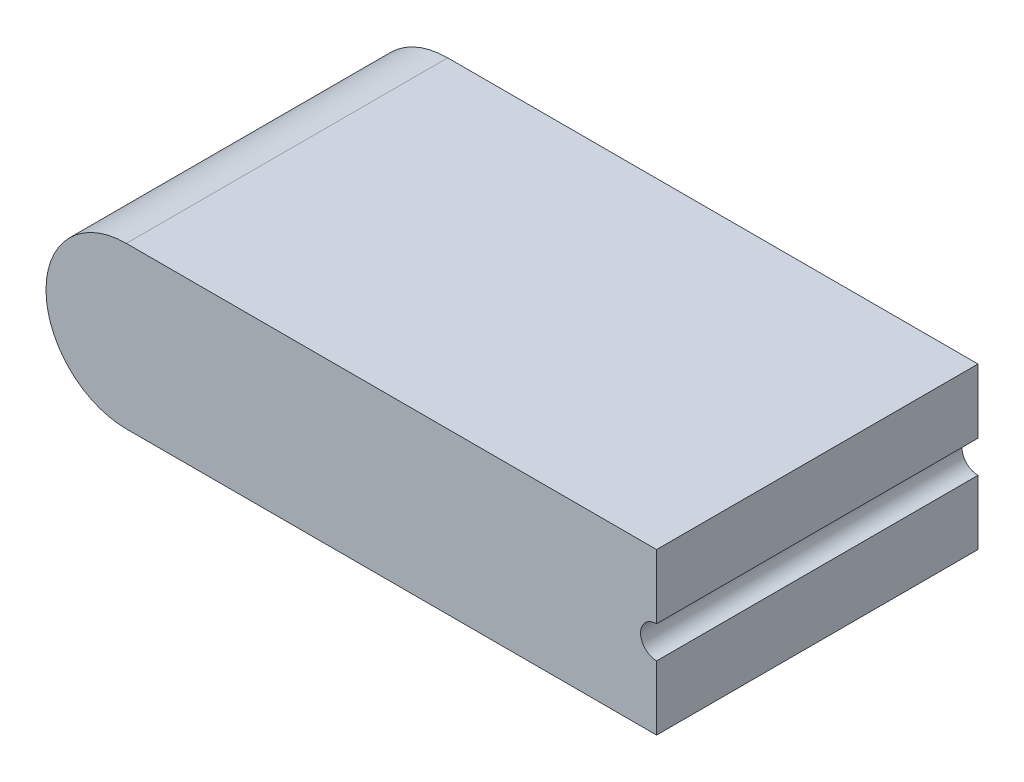
from build123d import *

# Parameters (mm, degrees)
BOSS_EXTRUDE1_DEPTH              = 2.54
FILLET1_R                        = 1.27
F_97_0_0059_DIAMETER_HOLE2_D     = 0.508
F_97_0_0059_DIAMETER_HOLE2_DEPTH = 25.4
F_97_0_0059_DIAMETER_HOLE2_TIP   = 0.152618597


with BuildPart() as part:
    # Sketch1 → Boss-Extrude1 (new body)
    with BuildSketch(Plane(origin=(0, 0, 0), x_dir=(1, 0, 0), z_dir=(0, 1, 0))):
        Polygon((0, 0), (6.35, 0), (6.35, 5.08), (-3.302, 5.08), (-3.302, 0), align=None)
    extrude(amount=BOSS_EXTRUDE1_DEPTH)

    # Fillet1
    fillet1_edges = [part.edges().sort_by_distance(p)[0] for p in [
        (-3.302, 0, -2.54),
        (-3.302, 2.54, -2.54),
    ]]
    fillet(fillet1_edges, radius=FILLET1_R - 0.0001)  # a hair under: the kernel refuses the full size

    # #97 (0.0059) Diameter Hole2
    with Locations(Plane.XY):
        with Locations((6.35, 1.27)):
            Hole(F_97_0_0059_DIAMETER_HOLE2_D / 2, depth=F_97_0_0059_DIAMETER_HOLE2_DEPTH)
            with Locations((0, 0, -(F_97_0_0059_DIAMETER_HOLE2_DEPTH + F_97_0_0059_DIAMETER_HOLE2_TIP / 2))):  # 118° drill point
                Cone(0, F_97_0_0059_DIAMETER_HOLE2_D / 2, F_97_0_0059_DIAMETER_HOLE2_TIP, mode=Mode.SUBTRACT)


solid = part.part
